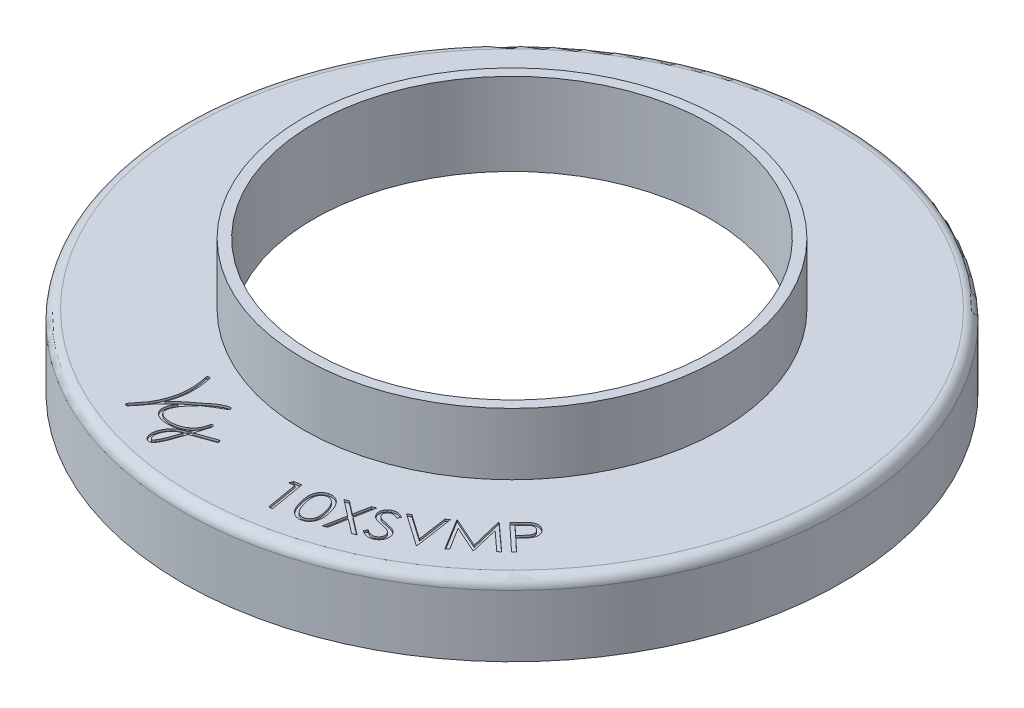
from build123d import *

# Parameters (mm, degrees)
SKETCH1_R                = 32
BOSS_EXTRUDE1_DEPTH      = 1
SKETCH2_R                = 19.25
CUT_EXTRUDE1_DEPTH       = 46.265881191
BOSS_EXTRUDE2_START      = 6
SKETCH3_R                = 32
SKETCH3_R_2              = 31.5
BOSS_EXTRUDE2_DEPTH      = 6
BOSS_EXTRUDE3_DEPTH      = 6
BOSS_EXTRUDE3_DEPTH_BACK = 2
SKETCH4_R                = 20.25
SKETCH4_R_2              = 19.25
FILLET1_R                = 1
TAG_DEPTH                = 0.2
COMPATIBILITY_TEXT_DEPTH = 0.2


with BuildPart() as part:
    # Sketch1 → Boss-Extrude1 (new body)
    with BuildSketch(Plane(origin=(0, 0, 0), x_dir=(1, 0, 0), z_dir=(0, 1, 0))):
        Circle(SKETCH1_R)
    extrude(amount=BOSS_EXTRUDE1_DEPTH)

    # Sketch2 → Cut-Extrude1 (cut, through all)
    with BuildSketch(Plane.XZ):
        Circle(SKETCH2_R)
    extrude(amount=-CUT_EXTRUDE1_DEPTH, mode=Mode.SUBTRACT)

    # Sketch3 → Boss-Extrude2 (add)
    with BuildSketch(Plane.XZ.offset(BOSS_EXTRUDE2_START)):
        Circle(SKETCH3_R)
        Circle(SKETCH3_R_2, mode=Mode.SUBTRACT)
    extrude(amount=-BOSS_EXTRUDE2_DEPTH)

    # Sketch4 → Boss-Extrude3 (add, two sides: drawn at the far end of the back side and taken through both)
    with BuildSketch(Plane(origin=(0, 1, 0), x_dir=(1, 0, 0), z_dir=(0, 1, 0)).offset(-BOSS_EXTRUDE3_DEPTH_BACK)):
        Circle(SKETCH4_R)
        Circle(SKETCH4_R_2, mode=Mode.SUBTRACT)
    extrude(amount=BOSS_EXTRUDE3_DEPTH + BOSS_EXTRUDE3_DEPTH_BACK)

    # Fillet1
    fillet1_edges = [part.edges().sort_by_distance(p)[0] for p in [
        (-32, 1, 0),
    ]]
    fillet(fillet1_edges, radius=FILLET1_R)

    # Sketch5 → Tag (cut)
    with BuildSketch(Plane(origin=(0, 1, 0), x_dir=(-1, 0, 0), z_dir=(0, 1, 0))):
        with BuildLine():
            ThreePointArc((10.547504807, 26.744009784), (10.762501606, 26.751175294), (10.769667116, 26.536178496))
            add(Edge.make_bspline(
                [(10.769667116, 26.536178496), (8.359942588, 23.963043087), (9.172058921, 20.559830458)],
                knots=[0, 0, 0, 1, 1, 1], degree=2))
            ThreePointArc((9.172058921, 20.559830458), (9.059283002, 20.376645961), (8.876098505, 20.48942188))
            add(Edge.make_bspline(
                [(10.547504807, 26.744009784), (8.031196572, 24.05143752), (8.876098505, 20.48942188)],
                knots=[0, 0, 0, 1, 1, 1], degree=2))
        make_face()
        with BuildLine():
            ThreePointArc((10.534270417, 26.727747601), (10.746239423, 26.764409685), (10.782901507, 26.552440679))
            add(Edge.make_bspline(
                [(10.782901507, 26.552440679), (8.696796986, 23.593964377), (5.496709323, 21.923279474)],
                knots=[0, 0, 0, 1, 1, 1], degree=2))
            ThreePointArc((5.496709323, 21.923279474), (5.291475436, 21.987731156), (5.355927118, 22.192965043))
            add(Edge.make_bspline(
                [(10.534270417, 26.727747601), (8.490657656, 23.829204131), (5.355927118, 22.192965043)],
                knots=[0, 0, 0, 1, 1, 1], degree=2))
        make_face()
        with BuildLine():
            ThreePointArc((5.918473616, 26.157590205), (5.722792881, 26.246943537), (5.812146213, 26.442624272))
            add(Edge.make_bspline(
                [(5.812146213, 26.442624272), (5.995414711, 26.510989656), (6.304529142, 26.742154319), (6.692476344, 27.319141867), (6.848542641, 27.923575729), (6.742443656, 28.288472399), (6.559286729, 28.429035448), (6.533379992, 28.432151338), (6.414940495, 28.368990764), (6.218827653, 28.077314295), (5.985024398, 27.561538715), (5.706192296, 26.796413886), (5.429323485, 25.922555064), (5.181407718, 25.084327905), (5.03985157, 24.587708128), (4.972706559, 24.348680798)],
                knots=[0, 0, 0, 0, 0.125, 0.25, 0.375, 0.5, 0.5625, 0.625, 0.6875, 0.75, 0.8125, 0.875, 0.9375, 0.96875, 1, 1, 1, 1], degree=3))
            ThreePointArc((4.972706559, 24.348680798), (4.785127723, 24.243375774), (4.679822699, 24.430954611))
            add(Edge.make_bspline(
                [(5.918473616, 26.157590205), (6.37174519, 26.326675922), (6.898390029, 26.954417097), (7.1709042, 27.893442168), (7.013518266, 28.441468489), (6.735696833, 28.709010273), (6.315363118, 28.761004784), (6.029261084, 28.390773259), (5.701440578, 27.673658549), (5.4175102, 26.892234197), (5.138340939, 26.011421915), (4.889185088, 25.168925801), (4.747200576, 24.670810912), (4.679822699, 24.430954611)],
                knots=[0, 0, 0, 0, 0.25, 0.375, 0.5, 0.5625, 0.625, 0.75, 0.8125, 0.875, 0.9375, 0.96875, 1, 1, 1, 1], degree=3))
        make_face()
        with BuildLine():
            ThreePointArc((3.278919729, 25.213091397), (3.084455876, 25.305063011), (3.176427489, 25.499526864))
            Line((3.176427489, 25.499526864), (5.814063795, 26.443324972))
            ThreePointArc((5.814063795, 26.443324972), (6.008527648, 26.351353358), (5.916556034, 26.156889505))
            Line((5.916556034, 26.156889505), (3.278919729, 25.213091397))
        make_face()
        with BuildLine():
            ThreePointArc((5.431809199, 21.906111295), (5.274307257, 22.052631281), (5.420827242, 22.210133222))
            add(Edge.make_bspline(
                [(5.420827242, 22.210133222), (5.471768801, 22.211973346), (5.558959348, 22.228448182), (5.833018113, 22.327738507), (6.241108244, 22.563266849), (6.790036287, 22.982709017), (7.513070963, 23.663310303), (8.271085244, 24.648483579), (8.438511524, 25.440659511), (8.147012134, 25.802826348), (7.477980546, 26.086872851), (5.893309591, 26.047325397), (5.056368276, 25.078538458), (4.977431814, 24.372907169)],
                knots=[0, 0, 0, 0, 0.03125, 0.0625, 0.125, 0.1875, 0.25, 0.375, 0.5, 0.5625, 0.625, 0.75, 1, 1, 1, 1], degree=3))
            ThreePointArc((4.977431814, 24.372907169), (4.809354094, 24.23865052), (4.675097445, 24.406728239))
            add(Edge.make_bspline(
                [(5.431809199, 21.906111295), (5.591205408, 21.911869045), (5.873496596, 22.00482733), (6.596165042, 22.413839944), (7.582648615, 23.25862214), (8.52509514, 24.47159273), (8.798575231, 25.470556207), (8.31117097, 26.081122872), (7.514422521, 26.390885548), (5.755297935, 26.360759465), (4.766423612, 25.223113968), (4.675097445, 24.406728239)],
                knots=[0, 0, 0, 0, 0.0625, 0.125, 0.25, 0.375, 0.5, 0.5625, 0.625, 0.75, 1, 1, 1, 1], degree=3))
        make_face()
    extrude(amount=-TAG_DEPTH, mode=Mode.SUBTRACT)

    # Sketch6 → Compatibility text (cut)
    # profile 1 of 7: a face of its own
    with BuildSketch(Plane(origin=(0, 1, 0), x_dir=(1, 0, 0), z_dir=(0, 1, 0))):
        Polygon((3.868242415, -25.062640832), (4.539917095, -24.946955736), (5.129560524, -28.363522242), (4.790217576, -28.421715351), (4.258066133, -25.339583941), (3.72170796, -25.43283314), align=None)
    # profile 2 of 7: a face of its own
    with BuildSketch(Plane(origin=(0, 1, 0), x_dir=(1, 0, 0), z_dir=(0, 1, 0))):
        with BuildLine():
            add(Edge.make_bspline(
                [(5.926963617, -26.458229337), (5.912859291, -26.404322564), (5.885478905, -26.29967466), (5.850838572, -26.14613185), (5.824444366, -26.000774416), (5.803577061, -25.86383294), (5.790152893, -25.734918907), (5.783576717, -25.614164708), (5.78400525, -25.501528707), (5.791611299, -25.396340424), (5.806050621, -25.297653257), (5.824582426, -25.203836434), (5.849607185, -25.114863489), (5.87780918, -25.029716992), (5.912193631, -24.949442285), (5.952659894, -24.874445936), (5.996637128, -24.80293439), (6.046545625, -24.736649291), (6.100373361, -24.674941199), (6.158258675, -24.618395919), (6.219828485, -24.567480064), (6.284566147, -24.521450835), (6.353036065, -24.481532248), (6.424587973, -24.446262638), (6.499946031, -24.416677786), (6.552007037, -24.401229424), (6.578305765, -24.393425651)],
                knots=[0, 0, 0, 0, 1.647318746, 3.197899717, 4.65205409, 6.014213355, 7.292310693, 8.48236051, 9.587892796, 10.620201329, 11.597343965, 12.535044578, 13.445257008, 14.327990597, 15.185346259, 16.023014571, 16.84549939, 17.664960357, 18.472892474, 19.264438324, 20.054444699, 20.832761964, 21.610127909, 22.395011307, 23.189236544, 24, 24, 24, 24], degree=3))
            add(Edge.make_bspline(
                [(6.578305765, -24.393425651), (6.605326559, -24.386707299), (6.658979615, -24.373367197), (6.74035637, -24.360707139), (6.821264032, -24.355511965), (6.901677262, -24.354947317), (6.981845357, -24.362352906), (7.061785067, -24.375584281), (7.141250964, -24.395311825), (7.219938165, -24.421458483), (7.297826093, -24.453381673), (7.373860866, -24.493133425), (7.448292349, -24.539356634), (7.520434103, -24.59293374), (7.590911547, -24.65291265), (7.659647573, -24.71955104), (7.726273694, -24.793422082), (7.790927107, -24.8743917), (7.853759274, -24.963002722), (7.913322621, -25.061122995), (7.970453577, -25.168176093), (8.025595684, -25.284540798), (8.076805337, -25.410476681), (8.126154895, -25.545573918), (8.172182167, -25.69003751), (8.200299353, -25.78997316), (8.214724034, -25.841242157)],
                knots=[0, 0, 0, 0, 0.817182526, 1.622614767, 2.413567539, 3.195752124, 3.980940271, 4.773914118, 5.572684809, 6.381994599, 7.206403894, 8.041113207, 8.897865577, 9.77613472, 10.676635341, 11.613116778, 12.5846588, 13.595130526, 14.653568729, 15.771471278, 16.962509194, 18.214742351, 19.550065738, 20.952251152, 22.43644356, 24, 24, 24, 24], degree=3))
            add(Edge.make_bspline(
                [(8.214724034, -25.841242157), (8.228192243, -25.892565026), (8.254472537, -25.992710492), (8.286515873, -26.140567911), (8.312116839, -26.281546473), (8.330143644, -26.415626746), (8.342888171, -26.542814159), (8.346700873, -26.663399779), (8.34512512, -26.77741895), (8.336053797, -26.884938556), (8.320227987, -26.986661585), (8.300075194, -27.083375264), (8.27507511, -27.175584891), (8.244054843, -27.262635969), (8.208330586, -27.344926643), (8.167506573, -27.422620786), (8.121268885, -27.49552073), (8.069888047, -27.563500948), (8.01494109, -27.626694886), (7.955127812, -27.683550573), (7.893355646, -27.736576497), (7.826659287, -27.78265964), (7.757550426, -27.824631343), (7.683741293, -27.85906977), (7.607713265, -27.890900867), (7.554448793, -27.906102569), (7.527624675, -27.913758183)],
                knots=[0, 0, 0, 0, 1.5588063, 3.041672963, 4.443805939, 5.767407041, 7.015717274, 8.197477382, 9.310044622, 10.364407922, 11.36466006, 12.332937016, 13.265798914, 14.169262016, 15.045651869, 15.899533595, 16.745315162, 17.578912031, 18.401204886, 19.202472366, 20.001648185, 20.790312371, 21.581662244, 22.374024339, 23.181154688, 24, 24, 24, 24], degree=3))
            add(Edge.make_bspline(
                [(7.527624675, -27.913758183), (7.50105852, -27.920188746), (7.448270427, -27.932966553), (7.368396731, -27.945733811), (7.288866916, -27.951270881), (7.209893099, -27.950385441), (7.131355069, -27.944255483), (7.052935556, -27.931725904), (6.975347623, -27.9115958), (6.89791168, -27.886801172), (6.82226388, -27.854340576), (6.748407323, -27.815349708), (6.675672707, -27.770968955), (6.606745993, -27.717384875), (6.53809709, -27.659479171), (6.472468919, -27.593892594), (6.408390182, -27.522168774), (6.346314189, -27.443195813), (6.286380418, -27.355376251), (6.228028058, -27.258008011), (6.173345755, -27.14946814), (6.118823135, -27.031752523), (6.068257848, -26.902861662), (6.018334004, -26.764096706), (5.970775649, -26.614846699), (5.941830639, -26.511375327), (5.926963617, -26.458229337)],
                knots=[0, 0, 0, 0, 0.808657397, 1.606837047, 2.390289485, 3.164900862, 3.941978179, 4.71967076, 5.511382438, 6.311835939, 7.12368099, 7.943440948, 8.782091531, 9.641056005, 10.5239645, 11.438459546, 12.383814903, 13.368887316, 14.408597664, 15.528247058, 16.725256837, 18.003351343, 19.365941089, 20.820665205, 22.366998611, 24, 24, 24, 24], degree=3))
        make_face()
        with BuildLine():
            add(Edge.make_bspline(
                [(6.245974034, -26.379703696), (6.258617102, -26.425336928), (6.283142723, -26.513858431), (6.322280101, -26.641632469), (6.362791344, -26.75993427), (6.404219373, -26.868560125), (6.445388892, -26.968010681), (6.48776333, -27.057898471), (6.532322121, -27.137731402), (6.576281434, -27.209809204), (6.623601183, -27.273120641), (6.670839683, -27.33181633), (6.721034128, -27.384256292), (6.772010712, -27.432424452), (6.825682273, -27.474626183), (6.881103226, -27.51168551), (6.937976044, -27.544473618), (7.015572431, -27.579011242), (7.113151099, -27.611411767), (7.230669028, -27.630356241), (7.34648873, -27.632129765), (7.420533325, -27.615615482), (7.457512496, -27.607367959)],
                knots=[0, 0, 0, 0, 1.473372424, 2.858117585, 4.1574534, 5.363515515, 6.475019352, 7.506136466, 8.453317272, 9.318964378, 10.130570391, 10.910849912, 11.66187898, 12.387371532, 13.091520839, 13.783320342, 14.460713421, 15.131161915, 16.42358073, 17.646602107, 18.824671766, 20, 20, 20, 20], degree=3))
            add(Edge.make_bspline(
                [(7.457512496, -27.607367959), (7.493836532, -27.595849864), (7.566490101, -27.572811933), (7.66573718, -27.513927382), (7.757234576, -27.440032154), (7.824045891, -27.364424121), (7.872096845, -27.296397455), (7.904356459, -27.240743226), (7.932801324, -27.181307476), (7.95619757, -27.117802086), (7.97586533, -27.050525545), (7.992181701, -26.97992155), (8.003329596, -26.905118044), (8.007275358, -26.853927148), (8.009295348, -26.827720523)],
                knots=[0, 0, 0, 0, 1.337542436, 2.675287253, 4.032070833, 5.46540812, 6.209459246, 6.961517233, 7.7269107, 8.526087935, 9.340864434, 10.193033937, 11.074943263, 12, 12, 12, 12], degree=3))
            add(Edge.make_bspline(
                [(8.009295348, -26.827720523), (8.011336198, -26.794546392), (8.015487245, -26.727070886), (8.014152836, -26.623845987), (8.008554719, -26.517192521), (7.99813454, -26.406966378), (7.981695399, -26.293358975), (7.9605419, -26.176230095), (7.934888025, -26.055429225), (7.913578548, -25.974373714), (7.902724835, -25.933089113)],
                knots=[0, 0, 0, 0, 0.881030868, 1.791998865, 2.735234085, 3.712580562, 4.726548576, 5.777999548, 6.868252096, 8, 8, 8, 8], degree=3))
            add(Edge.make_bspline(
                [(7.902724835, -25.933089113), (7.891307278, -25.891879262), (7.869015627, -25.811421105), (7.83189735, -25.694926449), (7.792101934, -25.585312218), (7.752447292, -25.481558176), (7.708315421, -25.385410711), (7.663748564, -25.295671833), (7.617541592, -25.212234599), (7.568338877, -25.13600355), (7.517870107, -25.065921932), (7.466772892, -25.001680267), (7.413911125, -24.943979757), (7.360136003, -24.892121589), (7.305297391, -24.846115376), (7.249055886, -24.80660004), (7.191206141, -24.773505289), (7.114172585, -24.737793097), (7.017222786, -24.706038577), (6.901057696, -24.685336539), (6.786139843, -24.685358559), (6.712513087, -24.701081984), (6.675761694, -24.708930459)],
                knots=[0, 0, 0, 0, 1.3316506, 2.599916023, 3.806253024, 4.963187981, 6.057654804, 7.099224859, 8.08326226, 9.026090166, 9.922933547, 10.772021291, 11.580818055, 12.35808671, 13.09706517, 13.807798416, 14.495693454, 15.169742059, 16.449421259, 17.660316445, 18.832127963, 20, 20, 20, 20], degree=3))
            add(Edge.make_bspline(
                [(6.675761694, -24.708930459), (6.639455329, -24.720733807), (6.566913105, -24.744317582), (6.466958306, -24.803359876), (6.374623139, -24.878182252), (6.307376473, -24.955342012), (6.258476294, -25.023782743), (6.226013249, -25.080069237), (6.19729685, -25.139535097), (6.172534308, -25.203030811), (6.152796113, -25.27027175), (6.13524174, -25.340744887), (6.124094028, -25.415204145), (6.115192264, -25.493733944), (6.111556317, -25.578084353), (6.115126793, -25.669356224), (6.122723963, -25.768568657), (6.136298333, -25.875682582), (6.155361235, -25.990720756), (6.180081142, -26.113445), (6.210304241, -26.244126405), (6.233815375, -26.333489857), (6.245974034, -26.379703696)],
                knots=[0, 0, 0, 0, 1.184577991, 2.366855546, 3.58641639, 4.86887465, 5.536586514, 6.20124338, 6.887384804, 7.589481153, 8.318613759, 9.06632346, 9.846859142, 10.658601925, 11.524570779, 12.470200542, 13.4984749, 14.619426562, 15.827861958, 17.125420655, 18.513426426, 20, 20, 20, 20], degree=3))
        make_face(mode=Mode.SUBTRACT)
    # profile 3 of 7: a face of its own
    with BuildSketch(Plane(origin=(0, 1, 0), x_dir=(1, 0, 0), z_dir=(0, 1, 0))):
        Polygon((7.8138132, -24.130593037), (8.194522335, -23.986161948), (9.456541566, -24.960020121), (9.758725059, -23.391610666), (10.135227463, -23.248581819), (9.765035155, -25.194895922), (11.435808393, -26.47935105), (11.055099258, -26.624483262), (9.691417367, -25.579811787), (9.36048788, -27.268113069), (8.979778745, -27.412544159), (9.38011929, -25.341430377), align=None)
    # profile 4 of 7: a face of its own
    with BuildSketch(Plane(origin=(0, 1, 0), x_dir=(1, 0, 0), z_dir=(0, 1, 0))):
        with BuildLine():
            Line((11.370361918, -25.809718738), (11.558262559, -25.520155436))
            add(Edge.make_bspline(
                [(11.558262559, -25.520155436), (11.601491649, -25.549655484), (11.684134449, -25.606051918), (11.810145209, -25.675093679), (11.930765641, -25.727603094), (12.046847996, -25.761788005), (12.158084316, -25.778928588), (12.264053826, -25.777359044), (12.365864723, -25.760326364), (12.428068861, -25.733435103), (12.459204066, -25.719975148)],
                knots=[0, 0, 0, 0, 1.295301958, 2.476281192, 3.552276847, 4.546731989, 5.465004202, 6.327359462, 7.162788728, 8, 8, 8, 8], degree=3))
            add(Edge.make_bspline(
                [(12.459204066, -25.719975148), (12.484900801, -25.706442697), (12.535748144, -25.679665398), (12.603653926, -25.627000089), (12.666436936, -25.569111302), (12.719594833, -25.502278495), (12.765170552, -25.431660318), (12.80043579, -25.357357432), (12.822462351, -25.280315827), (12.834991453, -25.202070961), (12.834898933, -25.124034915), (12.827328167, -25.047469576), (12.80726592, -24.973923684), (12.786975232, -24.927715023), (12.776812239, -24.9045705)],
                knots=[0, 0, 0, 0, 1.072470733, 2.122148444, 3.168080287, 4.225422053, 5.271210932, 6.273077813, 7.255313488, 8.226257622, 9.19469609, 10.134256852, 11.065505583, 12, 12, 12, 12], degree=3))
            add(Edge.make_bspline(
                [(12.776812239, -24.9045705), (12.762724969, -24.878976674), (12.734372571, -24.82746589), (12.67487089, -24.759631277), (12.603459534, -24.698362772), (12.548117367, -24.665601526), (12.51950054, -24.648661045)],
                knots=[0, 0, 0, 0, 0.94880255, 1.909584064, 2.919068894, 4, 4, 4, 4], degree=3))
            add(Edge.make_bspline(
                [(12.51950054, -24.648661045), (12.497450519, -24.637122388), (12.45108194, -24.61285796), (12.374988647, -24.581390788), (12.290627448, -24.549676418), (12.197347384, -24.518880189), (12.095082927, -24.489650178), (11.983918323, -24.461816274), (11.864310984, -24.434303279), (11.781268992, -24.41798998), (11.738450861, -24.409578513)],
                knots=[0, 0, 0, 0, 0.728355502, 1.531645251, 2.40864669, 3.367279854, 4.406878053, 5.522184859, 6.722388391, 8, 8, 8, 8], degree=3))
            add(Edge.make_bspline(
                [(11.738450861, -24.409578513), (11.695674953, -24.400970325), (11.614030262, -24.384540216), (11.497435531, -24.360444278), (11.393002736, -24.335841712), (11.300233739, -24.311915279), (11.218806424, -24.289440805), (11.149647132, -24.265898505), (11.091262296, -24.245034957), (11.057546666, -24.228489698), (11.042236918, -24.22097675)],
                knots=[0, 0, 0, 0, 1.448353549, 2.764415384, 3.951748073, 5.009164883, 5.94474335, 6.754281454, 7.434338416, 8, 8, 8, 8], degree=3))
            add(Edge.make_bspline(
                [(11.042236918, -24.22097675), (11.020119541, -24.208848431), (10.976512876, -24.184936213), (10.914448152, -24.145028229), (10.857342104, -24.100773919), (10.805675518, -24.052048517), (10.757606674, -24.000754153), (10.713841933, -23.945931634), (10.675094955, -23.887004509), (10.653455558, -23.845145521), (10.642597495, -23.824141814)],
                knots=[0, 0, 0, 0, 1.056044959, 2.082100275, 3.086315605, 4.076461093, 5.052775422, 6.027862824, 7.010435015, 8, 8, 8, 8], degree=3))
            add(Edge.make_bspline(
                [(10.642597495, -23.824141814), (10.627373008, -23.790146357), (10.59748305, -23.723403697), (10.569678289, -23.617941914), (10.555154208, -23.511454049), (10.556235233, -23.404132026), (10.570601981, -23.297898547), (10.600296653, -23.194993866), (10.644606267, -23.096389266), (10.701934144, -23.00274138), (10.771669194, -22.916191757), (10.85225836, -22.83948801), (10.942125043, -22.77212898), (11.008522811, -22.737007258), (11.042236918, -22.719173866)],
                knots=[0, 0, 0, 0, 1.021598489, 2.005685583, 2.98340896, 3.965526243, 4.944113138, 5.919283625, 6.896248161, 7.904653705, 8.927179399, 9.939601577, 10.953812847, 12, 12, 12, 12], degree=3))
            add(Edge.make_bspline(
                [(11.042236918, -22.719173866), (11.07926628, -22.702790894), (11.152679686, -22.670310461), (11.268975536, -22.638610379), (11.388320578, -22.623337109), (11.490022024, -22.62331352), (11.574029986, -22.631604245), (11.641059381, -22.64358611), (11.711356132, -22.661586793), (11.785184554, -22.683914538), (11.862495043, -22.712378281), (11.943542791, -22.745795457), (12.02773142, -22.785389164), (12.084420402, -22.814361863), (12.113551021, -22.829249988)],
                knots=[0, 0, 0, 0, 1.296188055, 2.569787194, 3.846113717, 5.141717499, 5.819092712, 6.549226026, 7.321178517, 8.143234901, 9.019804466, 9.95996975, 10.951695003, 12, 12, 12, 12], degree=3))
            Line((12.113551021, -22.829249988), (11.95299413, -23.147559282))
            add(Edge.make_bspline(
                [(11.95299413, -23.147559282), (11.929469865, -23.135707133), (11.884368934, -23.112984086), (11.817592144, -23.082657677), (11.755350078, -23.056000164), (11.696490328, -23.034166453), (11.642289413, -23.016034717), (11.591968721, -23.001173631), (11.54536676, -22.992601534), (11.489386385, -22.984617602), (11.422437588, -22.984004435), (11.344061032, -22.992749177), (11.267444789, -23.013431907), (11.218918494, -23.034527935), (11.194380348, -23.0451955)],
                knots=[0, 0, 0, 0, 1.188266744, 2.278155691, 3.308210182, 4.242388565, 5.109287227, 5.88702707, 6.606632989, 7.24485638, 8.436486414, 9.614841564, 10.79390408, 12, 12, 12, 12], degree=3))
            add(Edge.make_bspline(
                [(11.194380348, -23.0451955), (11.164664316, -23.061139089), (11.107283649, -23.091925627), (11.035320263, -23.155304372), (10.978358869, -23.22807347), (10.938729924, -23.309954069), (10.916272938, -23.396272612), (10.910655244, -23.483604123), (10.925018341, -23.570550231), (10.947841753, -23.624697599), (10.959504547, -23.652366975)],
                knots=[0, 0, 0, 0, 1.109948636, 2.143273776, 3.138466436, 4.142380015, 5.122754186, 6.065378846, 7.011406038, 8, 8, 8, 8], degree=3))
            add(Edge.make_bspline(
                [(10.959504547, -23.652366975), (10.968160482, -23.6692412), (10.985387514, -23.702824264), (11.019431033, -23.748227513), (11.056385756, -23.791420947), (11.099325017, -23.83156683), (11.149830255, -23.868423783), (11.209892946, -23.901961235), (11.278895562, -23.934226405), (11.329290064, -23.952176596), (11.355638361, -23.961561686)],
                knots=[0, 0, 0, 0, 0.878551653, 1.748492485, 2.624899365, 3.515022782, 4.469487542, 5.518757194, 6.702705272, 8, 8, 8, 8], degree=3))
            add(Edge.make_bspline(
                [(11.355638361, -23.961561686), (11.365195954, -23.964456438), (11.387884968, -23.971328364), (11.428282492, -23.9806766), (11.480049367, -23.992874997), (11.543999723, -24.005774375), (11.619393867, -24.021422901), (11.706669609, -24.037971516), (11.805432206, -24.057173163), (11.875387705, -24.069850923), (11.912329066, -24.076545661)],
                knots=[0, 0, 0, 0, 0.421393142, 1.000355918, 1.74931085, 2.666297811, 3.753495249, 4.999339062, 6.415442656, 8, 8, 8, 8], degree=3))
            add(Edge.make_bspline(
                [(11.912329066, -24.076545661), (11.957031498, -24.084878609), (12.043429268, -24.100983955), (12.167900898, -24.129497614), (12.283773145, -24.158636372), (12.390816318, -24.189763449), (12.488635859, -24.223784619), (12.577850372, -24.258365344), (12.6580508, -24.295404403), (12.729637475, -24.334983371), (12.794045329, -24.377117408), (12.853777774, -24.420302059), (12.908772099, -24.466251191), (12.959550177, -24.514174407), (13.00401335, -24.565917702), (13.045372666, -24.618449385), (13.081320618, -24.674189322), (13.101725387, -24.713233827), (13.111948457, -24.732795661)],
                knots=[0, 0, 0, 0, 1.536613605, 2.969860479, 4.314631524, 5.574250126, 6.735724923, 7.813744142, 8.806697805, 9.718836349, 10.575425007, 11.406396118, 12.208332658, 12.995984197, 13.762767083, 14.511604304, 15.254293297, 16, 16, 16, 16], degree=3))
            add(Edge.make_bspline(
                [(13.111948457, -24.732795661), (13.124998722, -24.761046422), (13.15080231, -24.816905136), (13.177567826, -24.904436858), (13.196472295, -24.992606984), (13.204517691, -25.082234908), (13.204118955, -25.172941483), (13.19306155, -25.264712327), (13.173491799, -25.357749241), (13.143960176, -25.45046079), (13.107315545, -25.541262751), (13.062726765, -25.627099549), (13.00930049, -25.705755401), (12.950328107, -25.779734486), (12.883015261, -25.84663983), (12.808461632, -25.907461329), (12.727071577, -25.96274292), (12.668012706, -25.993302409), (12.637990124, -26.008837327)],
                knots=[0, 0, 0, 0, 0.987161689, 1.951861861, 2.899395588, 3.846115183, 4.803508326, 5.774695289, 6.776120858, 7.818296718, 8.860181869, 9.882616751, 10.882969261, 11.875111939, 12.882678591, 13.889944545, 14.92735312, 16, 16, 16, 16], degree=3))
            add(Edge.make_bspline(
                [(12.637990124, -26.008837327), (12.614331232, -26.020017929), (12.567531221, -26.042134447), (12.494711387, -26.067549268), (12.421816387, -26.088996133), (12.34796041, -26.104372121), (12.273670232, -26.114280086), (12.198677388, -26.118232303), (12.122980861, -26.117920466), (12.046289559, -26.110782563), (11.968341769, -26.097002921), (11.888405731, -26.077789951), (11.806843189, -26.049843064), (11.723450583, -26.015248908), (11.637687998, -25.974510694), (11.549816211, -25.926702826), (11.460330263, -25.87111972), (11.400827363, -25.830510587), (11.370361918, -25.809718738)],
                knots=[0, 0, 0, 0, 0.926114293, 1.831960723, 2.727845391, 3.615780478, 4.500740252, 5.379485344, 6.273417983, 7.179377844, 8.103307422, 9.07490636, 10.08782564, 11.152995361, 12.271068101, 13.448848202, 14.693811982, 16, 16, 16, 16], degree=3))
        make_face()
    # profile 5 of 7: a face of its own
    with BuildSketch(Plane(origin=(0, 1, 0), x_dir=(1, 0, 0), z_dir=(0, 1, 0))):
        Polygon((12.061518949, -22.305922072), (12.384034975, -22.104700117), (14.792388341, -23.785990181), (14.365405167, -20.871426879), (14.687921193, -20.670906046), (15.243910776, -24.438734572), (15.179407571, -24.479399636), align=None)
    # profile 6 of 7: a face of its own
    with BuildSketch(Plane(origin=(0, 1, 0), x_dir=(1, 0, 0), z_dir=(0, 1, 0))):
        Polygon((16.869498905, -23.384907718), (15.029054193, -20.395324384), (15.072523744, -20.358866051), (17.981478071, -21.651033519), (17.236185603, -18.563293134), (17.280356276, -18.526133679), (19.884322623, -20.882604032), (19.620700828, -21.101354032), (17.770440411, -19.406041532), (18.413369097, -22.103958199), (18.346061405, -22.15934682), (15.787667975, -21.027736243), (17.127511725, -23.17106557), align=None)
    # profile 7 of 7: a face of its own
    with BuildSketch(Plane(origin=(0, 1, 0), x_dir=(1, 0, 0), z_dir=(0, 1, 0))):
        with BuildLine():
            Line((17.82189987, -18.037400616), (18.295157082, -17.529788436))
            add(Edge.make_bspline(
                [(18.295157082, -17.529788436), (18.327845113, -17.49517173), (18.390604425, -17.42870946), (18.480970763, -17.333974879), (18.565791998, -17.250498906), (18.64229393, -17.176221308), (18.71221244, -17.111945379), (18.774472027, -17.057452036), (18.830345957, -17.013107887), (18.866210113, -16.988580085), (18.882697146, -16.977304462)],
                knots=[0, 0, 0, 0, 1.414342715, 2.715464196, 3.888729925, 4.949259755, 5.882799716, 6.709616039, 7.406800393, 8, 8, 8, 8], degree=3))
            add(Edge.make_bspline(
                [(18.882697146, -16.977304462), (18.903963981, -16.963803973), (18.945982663, -16.937129918), (19.012620721, -16.904618059), (19.079728334, -16.876054527), (19.148542325, -16.854313676), (19.218561617, -16.839173232), (19.289466171, -16.828123011), (19.361987516, -16.824313124), (19.435361348, -16.825525011), (19.508886584, -16.833016405), (19.581114111, -16.847929013), (19.652035014, -16.869113433), (19.721518866, -16.897257905), (19.789802559, -16.932483024), (19.856302725, -16.974935076), (19.922076464, -17.023224203), (19.963192227, -17.060141103), (19.984159486, -17.078967122)],
                knots=[0, 0, 0, 0, 1.007177967, 1.989966503, 2.96251342, 3.923709459, 4.872082872, 5.826934916, 6.791763263, 7.773839699, 8.761111519, 9.744122482, 10.720438626, 11.718940064, 12.739444436, 13.79017875, 14.873086872, 16, 16, 16, 16], degree=3))
            add(Edge.make_bspline(
                [(19.984159486, -17.078967122), (20.004574654, -17.098761301), (20.044507488, -17.137479457), (20.098053033, -17.19974703), (20.144912787, -17.26327104), (20.18563683, -17.328493272), (20.218985544, -17.395473825), (20.246201484, -17.464089187), (20.265618948, -17.534452673), (20.278906116, -17.605994891), (20.286255522, -17.678260367), (20.285672303, -17.750739408), (20.280660891, -17.823319037), (20.267343009, -17.89561502), (20.249395076, -17.968487331), (20.223911749, -18.041058664), (20.192349199, -18.113765355), (20.166815366, -18.160745803), (20.15383096, -18.184636193)],
                knots=[0, 0, 0, 0, 1.119925791, 2.190616769, 3.231186637, 4.227761362, 5.216091496, 6.175383222, 7.131620646, 8.087015316, 9.039921744, 9.988368645, 10.939672052, 11.902492868, 12.880690436, 13.894097036, 14.929111058, 16, 16, 16, 16], degree=3))
            add(Edge.make_bspline(
                [(20.15383096, -18.184636193), (20.142381785, -18.203720705), (20.11728543, -18.245553559), (20.07091784, -18.309994187), (20.016616865, -18.384055895), (19.950557516, -18.465242797), (19.875545949, -18.555413438), (19.789116532, -18.652819456), (19.694324475, -18.759434254), (19.626725356, -18.832363969), (19.591531281, -18.870333308)],
                knots=[0, 0, 0, 0, 0.601134738, 1.317674858, 2.143705338, 3.082626267, 4.145092997, 5.313054578, 6.601097766, 8, 8, 8, 8], degree=3))
            Line((19.591531281, -18.870333308), (19.421859806, -19.052624975))
            Line((19.421859806, -19.052624975), (20.606054518, -20.156891802))
            Line((20.606054518, -20.156891802), (20.368374229, -20.411399013))
            Line((20.368374229, -20.411399013), (17.82189987, -18.037400616))
        make_face()
        with BuildLine():
            Line((18.307076152, -18.013562475), (19.172961569, -18.820553661))
            Line((19.172961569, -18.820553661), (19.57961221, -18.394271609))
            add(Edge.make_bspline(
                [(19.57961221, -18.394271609), (19.599148714, -18.373128026), (19.636904963, -18.332265936), (19.689210454, -18.271221921), (19.736787187, -18.213698166), (19.777909145, -18.158502638), (19.813586789, -18.106378172), (19.845274797, -18.058232316), (19.869526389, -18.01195889), (19.894838959, -17.955374379), (19.91662468, -17.885801841), (19.929864538, -17.80159556), (19.927849351, -17.716883486), (19.914128818, -17.632919144), (19.887169063, -17.551896051), (19.849880292, -17.475052261), (19.800361373, -17.40404996), (19.759510901, -17.362823014), (19.738766857, -17.341887795)],
                knots=[0, 0, 0, 0, 1.138647273, 2.200549814, 3.179492647, 4.091029493, 4.921877268, 5.678425411, 6.36906653, 6.985770047, 8.129024139, 9.241666702, 10.341950479, 11.466626091, 12.595094886, 13.707276474, 14.835745269, 16, 16, 16, 16], degree=3))
            add(Edge.make_bspline(
                [(19.738766857, -17.341887795), (19.717075235, -17.323214917), (19.674301817, -17.286394122), (19.601368243, -17.243111146), (19.523057703, -17.211546288), (19.440629743, -17.191295233), (19.356848873, -17.18300832), (19.274002616, -17.185878946), (19.193564091, -17.203289144), (19.128751798, -17.22832396), (19.076413169, -17.255002678), (19.035128711, -17.282532912), (18.990050326, -17.3145165), (18.942735632, -17.353421957), (18.892214978, -17.397348626), (18.839716327, -17.447765851), (18.783320879, -17.502878586), (18.745830655, -17.542730989), (18.726346986, -17.563442282)],
                knots=[0, 0, 0, 0, 1.160527503, 2.288428492, 3.425118814, 4.578289183, 5.722796786, 6.834167176, 7.930483897, 9.047915691, 9.646402447, 10.312411092, 11.060395376, 11.890397263, 12.798340044, 13.778456179, 14.845463661, 16, 16, 16, 16], degree=3))
            Line((18.726346986, -17.563442282), (18.307076152, -18.013562475))
        make_face(mode=Mode.SUBTRACT)
    extrude(amount=-COMPATIBILITY_TEXT_DEPTH, mode=Mode.SUBTRACT)


solid = part.part
